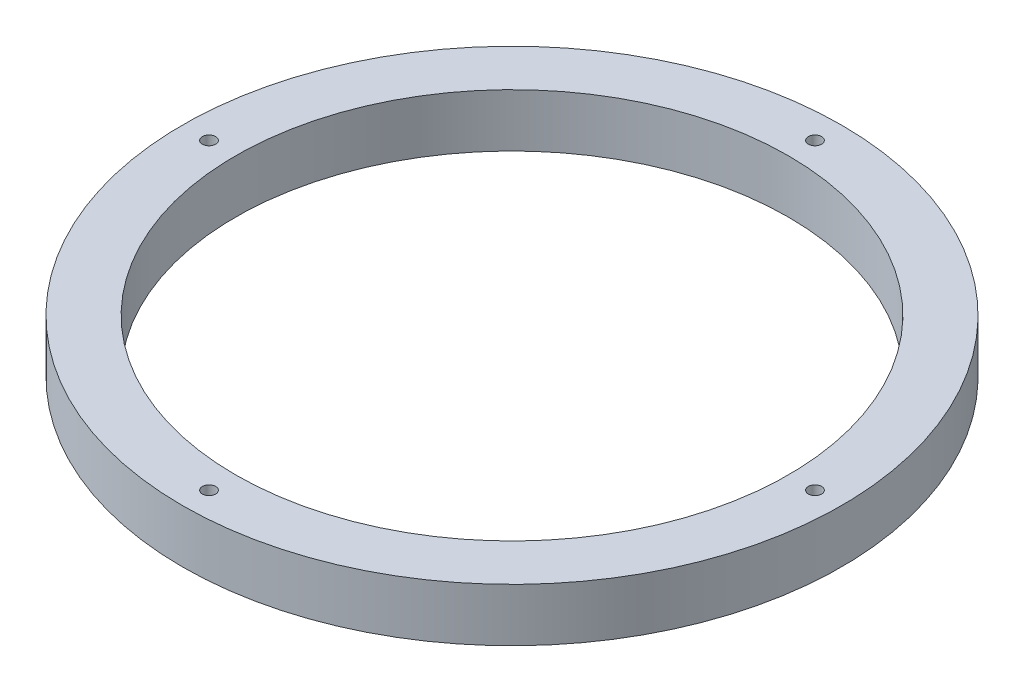
from build123d import *

# Parameters (mm, degrees)
SKETCH1_R           = 39.37
SKETCH1_R_2         = 33.02
SKETCH1_R_3         = 0.79375
BOSS_EXTRUDE1_DEPTH = 6.35


with BuildPart() as part:
    # Sketch1 → Boss-Extrude1 (new body)
    with BuildSketch(Plane(origin=(0, 0, 0), x_dir=(1, 0, 0), z_dir=(0, 1, 0))):
        Circle(SKETCH1_R)
        Circle(SKETCH1_R_2, mode=Mode.SUBTRACT)
        with Locations((0, 36.195)):
            Circle(SKETCH1_R_3, mode=Mode.SUBTRACT)
        with Locations((36.195, 0)):
            Circle(SKETCH1_R_3, mode=Mode.SUBTRACT)
        with Locations((0, -36.195)):
            Circle(SKETCH1_R_3, mode=Mode.SUBTRACT)
        with Locations((-36.195, 0)):
            Circle(SKETCH1_R_3, mode=Mode.SUBTRACT)
    extrude(amount=BOSS_EXTRUDE1_DEPTH)


solid = part.part
